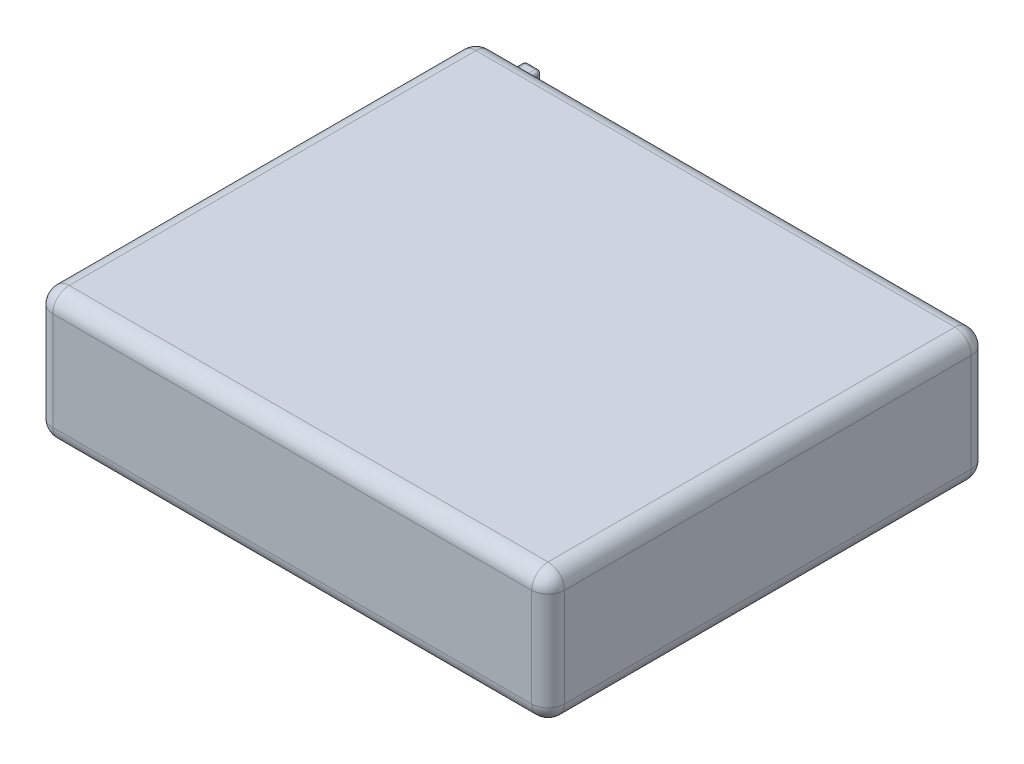
from build123d import *

# Parameters (mm, degrees)
BOSS_EXTRUDE1_DEPTH      = 10
BOSS_EXTRUDE1_DEPTH_BACK = 10
SKETCH1_W                = 78
SKETCH1_H                = 67
FILLET1_R                = 2.5
SKETCH2_W                = 2.5
SKETCH2_H                = 10
BOSS_EXTRUDE2_DEPTH      = 5
FILLET2_R                = 0.5


with BuildPart() as part:
    # Sketch1 → Boss-Extrude1 (new, two sides: drawn at the far end of the back side and taken through both)
    with BuildSketch(Plane(origin=(0, 0, 0), x_dir=(1, 0, 0), z_dir=(0, 1, 0)).offset(-BOSS_EXTRUDE1_DEPTH_BACK)):
        Rectangle(SKETCH1_W, SKETCH1_H)
    extrude(amount=BOSS_EXTRUDE1_DEPTH + BOSS_EXTRUDE1_DEPTH_BACK)

    # Fillet1
    fillet1_edges = [part.edges().sort_by_distance(p)[0] for p in [
        (-39, -10, 0),
        (0, -10, -33.5),
        (-39, 0, -33.5),
        (39, -10, 0),
        (39, 0, -33.5),
        (0, -10, 33.5),
        (-39, 0, 33.5),
        (39, 0, 33.5),
        (0, 10, 33.5),
        (-39, 10, 0),
        (0, 10, -33.5),
        (39, 10, 0),
    ]]
    fillet(fillet1_edges, radius=FILLET1_R)

    # Sketch2 → Boss-Extrude2 (add)
    with BuildSketch(Plane(origin=(0, 0, -33.5), x_dir=(-1, 0, 0), z_dir=(0, 0, -1))):
        with Locations((35.25, 0)):
            Rectangle(SKETCH2_W, SKETCH2_H)
    extrude(amount=BOSS_EXTRUDE2_DEPTH)

    # Fillet2
    fillet2_edges = [part.edges().sort_by_distance(p)[0] for p in [
        (-34, -5, -36),
        (-35.25, -5, -38.5),
        (-34, 0, -38.5),
        (-35.25, 5, -38.5),
        (-34, 5, -36),
        (-36.5, -5, -36),
        (-36.5, 0, -38.5),
        (-36.5, 5, -36),
    ]]
    fillet(fillet2_edges, radius=FILLET2_R)
    fillet2_2_edges = [part.edges().sort_by_distance(p)[0] for p in [
        (-34, 0, -33.5),
        (-35.25, -5, -33.5),
        (-35.25, 5, -33.5),
        (-36.5, 0, -33.5),
        (-36.353553391, 4.853553391, -33.5),
        (-36.353553391, -4.853553391, -33.5),
        (-34.146446609, 4.853553391, -33.5),
        (-34.146446609, -4.853553391, -33.5),
    ]]
    fillet(fillet2_2_edges, radius=FILLET2_R)


solid = part.part
